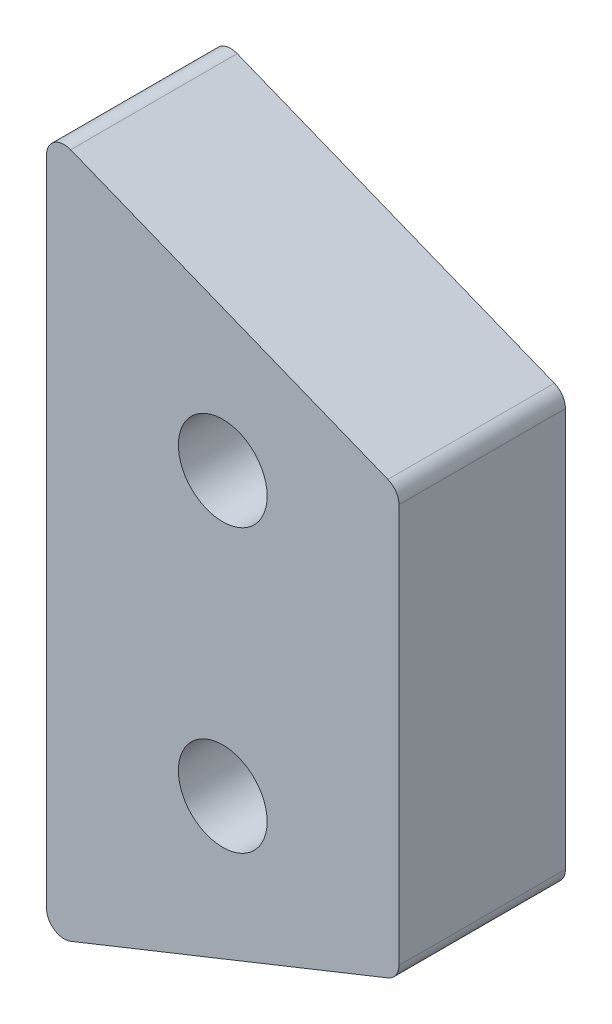
from build123d import *

# Parameters (mm, degrees)
SKETCH1_R           = 2
BOSS_EXTRUDE1_DEPTH = 7.5
FILLET1_R           = 0.79375
CUT_EXTRUDE1_DEPTH  = 4.25


with BuildPart() as part:
    # Sketch1 → Boss-Extrude1 (new body)
    with BuildSketch(Plane.XY):
        Polygon((0, 0), (15.875, -6.35), (15.875, -25.4), (0, -31.75), align=None)
        with Locations((7.9375, -22.225)):
            Circle(SKETCH1_R, mode=Mode.SUBTRACT)
        with Locations((7.9375, -9.525)):
            Circle(SKETCH1_R, mode=Mode.SUBTRACT)
    extrude(amount=BOSS_EXTRUDE1_DEPTH)

    # Fillet1
    fillet1_edges = [part.edges().sort_by_distance(p)[0] for p in [
        (0, -31.75, 3.75),
        (15.875, -25.4, 3.75),
        (15.875, -6.35, 3.75),
        (0, 0, 3.75),
    ]]
    fillet(fillet1_edges, radius=FILLET1_R)

    # Sketch2 → Cut-Extrude1 (cut)
    with BuildSketch(Plane.XY.offset(7.5)):
        with BuildLine():
            Line((14.6875, -22.225), (14.6875, -25.875))
            Line((14.6875, -25.875), (1.1875, -31.275))
            Line((1.1875, -31.275), (1.1875, -22.225))
            ThreePointArc((1.1875, -22.225), (7.9375, -15.475), (14.6875, -22.225))
        make_face()
    extrude(amount=-CUT_EXTRUDE1_DEPTH, mode=Mode.SUBTRACT)


with BuildPart() as body_2:
    # Mirror1: mirrored copy
    add(part.part.mirror(Plane(origin=(0, 0, 0), x_dir=(1, 0, 0), z_dir=(0, 0, -1))))


solid = body_2.part
